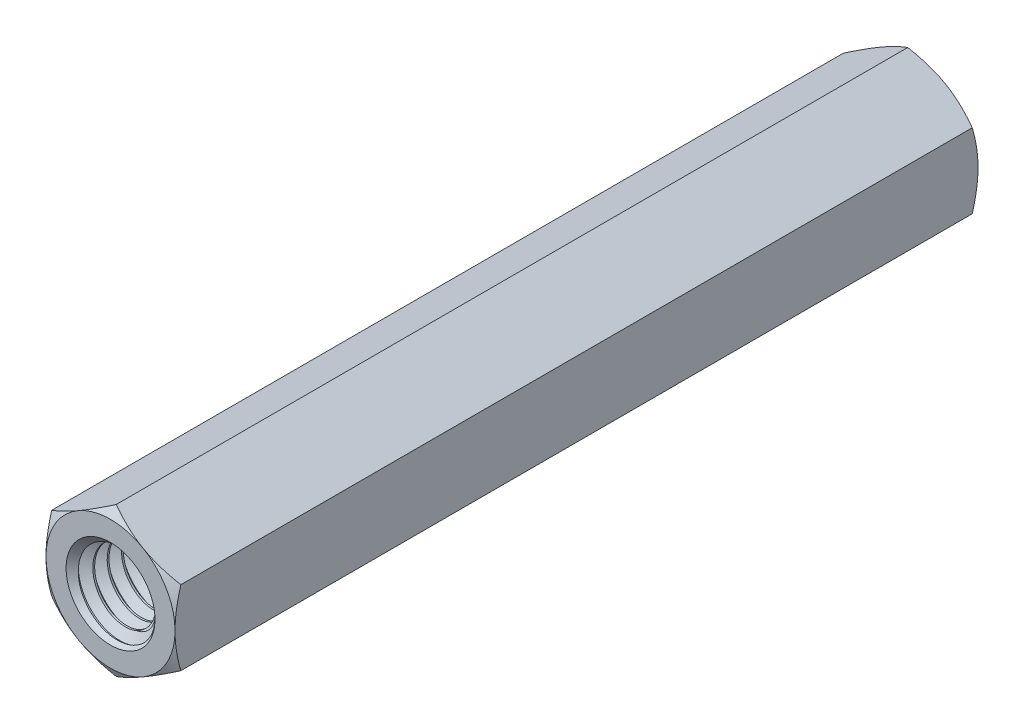
from build123d import *

# Parameters (mm, degrees)
EXTRUDE1_DEPTH          = 14
EXTRUDE1_DEPTH_BACK     = 14
SKETCH1_R               = 1.5
SWEEP1_PITCH            = 0.5
EXTRUDE2_DEPTH          = 29.706660889
SKETCH8_OUTSIDE_W       = 115.27
SKETCH8_OUTSIDE_H       = 115.966
SKETCH8_OUTSIDE_R       = 2.25
EXTRUDE4_DEPTH          = 29.706660889
EXTRUDE4_DRAFT          = -60
MIRROR1_COPY_1_SKETCH_W = 115.27
MIRROR1_COPY_1_SKETCH_H = 115.966
MIRROR1_COPY_1_SKETCH_R = 2.25
MIRROR1_COPY_1_DEPTH    = 29.706660889
MIRROR1_COPY_1_DRAFT    = -60
SKETCH9_W               = 15.4
SKETCH9_H               = 1.5508


with BuildPart() as part:
    # Sketch1 → Extrude1 (new, two sides: drawn at the far end of the back side and taken through both)
    with BuildSketch(Plane.XY.offset(-EXTRUDE1_DEPTH_BACK)):
        Polygon((0, 2.598076211), (-2.25, 1.299038106), (-2.25, -1.299038106), (0, -2.598076211), (2.25, -1.299038106), (2.25, 1.299038106), align=None)
        Circle(SKETCH1_R, mode=Mode.SUBTRACT)
    extrude(amount=EXTRUDE1_DEPTH + EXTRUDE1_DEPTH_BACK)

    # Sweep1: arcs per turn and ends read off the stored shape
    # Sweep1: the profile of Sketch12 profile screwed along a right-hand helix through 57 turns, 6 arcs to a turn; built about Z, then put on its axis
    sweep1_z = Axis((0, 0, 0), (0, 0, 1))
    sweep1_corners = [(1.5003, 0, -0.437673205), (1.5003, 0, 0.000173205), (1.175240474, 0, -0.1875), (1.175240474, 0, -0.25)]
    with BuildLine(mode=Mode.PRIVATE) as sweep1_profile:
        Line(sweep1_corners[0], sweep1_corners[1])
        Line(sweep1_corners[1], sweep1_corners[2])
        Line(sweep1_corners[2], sweep1_corners[3])
        Line(sweep1_corners[3], sweep1_corners[0])
    sweep1_cap = Face(sweep1_profile.wire())
    sweep1_turn_angles = [0, 30, 60, 90, 120, 150, 180, 210, 240, 270, 300, 330, 360]
    sweep1_turn_weights = [1, 0.8660254037844387, 1, 0.8660254037844387, 1, 0.8660254037844387, 1, 0.8660254037844387, 1, 0.8660254037844387, 1, 0.8660254037844387, 1]
    sweep1_turn_rails = [Edge.make_bspline([Vector(p[0], p[1], 0).rotate(sweep1_z, sweep1_turn_angles[k]) / sweep1_turn_weights[k] + Vector(0, 0, p[2] + SWEEP1_PITCH * sweep1_turn_angles[k] / 360) for k in range(13)], [0, 0, 0, 1, 1, 2, 2, 3, 3, 4, 4, 5, 5, 6, 6, 6], 2, sweep1_turn_weights) for p in sweep1_corners]
    sweep1_turn_sides = [Face.make_surface_from_curves(sweep1_turn_rails[p[0]], sweep1_turn_rails[p[1]]) for p in [(0, 1), (1, 2), (2, 3), (3, 0)]]
    sweep1 = Plane(origin=(0, 0, -14), x_dir=(0, 1, 0), z_dir=(0, 0, 1)) * Solid(Shell([*[p.moved(Location((0, 0, SWEEP1_PITCH * i))) for i in range(57) for p in sweep1_turn_sides], sweep1_cap, sweep1_cap.rotate(sweep1_z, 20520).moved(Location((0, 0, SWEEP1_PITCH * 20520 / 360)))]))
    add(sweep1)

    # Sketch6 → Extrude2 (cut, through all)
    with BuildSketch(Plane(origin=(0, 0, -14), x_dir=(-1, 0, 0), z_dir=(0, 0, -1))):
        Polygon((0, 2.598076211), (-2.25, 1.299038106), (-2.25, -1.299038106), (0, -2.598076211), (2.25, -1.299038106), (2.25, 1.299038106), align=None)
    extrude2 = extrude(amount=EXTRUDE2_DEPTH, mode=Mode.SUBTRACT)

    # Extrude3 cone 1 section (through the dimple's axis) → Extrude3 (revolve, cut)
    with BuildSketch(Plane(origin=(0, 0, -14), x_dir=(0, 1, 0), z_dir=(1, 0, 0))):
        Polygon((0, 0), (1.5508, 0), (0, 1.663029396), align=None)
    extrude3 = revolve(axis=Axis((0, 0, -14), (0, 0, 1)), mode=Mode.SUBTRACT)


with BuildPart() as extrude4_tool:
    # Sketch8 outside → Extrude4 (with draft: the straight prism first)
    with BuildSketch(Plane(origin=(0, 0, -14), x_dir=(-1, 0, 0), z_dir=(0, 0, -1))):
        Rectangle(SKETCH8_OUTSIDE_W, SKETCH8_OUTSIDE_H)
        Circle(SKETCH8_OUTSIDE_R, mode=Mode.SUBTRACT)
    extrude(amount=-EXTRUDE4_DEPTH)
    # Extrude4: the draft: its side faces are tilted about the plane it starts from
    extrude4_sides = [extrude4_tool.faces().sort_by_distance(p)[0] for p in [
        (0, -57.983, 0.853330444),
        (-57.635, 0, 0.853330444),
        (0, 57.983, 0.853330444),
        (57.635, 0, 0.853330444),
        (2.25, 0, 0.853330444),
    ]]
    draft(extrude4_sides, Plane(origin=(0, 0, -14), x_dir=(-1, 0, 0), z_dir=(0, 0, -1)), EXTRUDE4_DRAFT)


with BuildPart() as part_1:
    add(part.part)

    # Extrude4: cut by extrude4_tool
    add(extrude4_tool.part, mode=Mode.SUBTRACT)

    # Mirror1: Extrude2, Extrude3 across plane
    add(extrude2.mirror(Plane.XY), mode=Mode.SUBTRACT)
    add(extrude3.mirror(Plane.XY), mode=Mode.SUBTRACT)


with BuildPart() as mirror1_copy_1_tool:
    # Mirror1 copy 1 sketch → Mirror1 copy 1 (with draft: the straight prism first)
    with BuildSketch(Plane(origin=(0, 0, 14), x_dir=(-1, 0, 0), z_dir=(0, 0, 1))):
        Rectangle(MIRROR1_COPY_1_SKETCH_W, MIRROR1_COPY_1_SKETCH_H)
        Circle(MIRROR1_COPY_1_SKETCH_R, mode=Mode.SUBTRACT)
    extrude(amount=-MIRROR1_COPY_1_DEPTH)
    # Mirror1 copy 1: the draft: its side faces are tilted about the plane it starts from
    mirror1_copy_1_sides = [mirror1_copy_1_tool.faces().sort_by_distance(p)[0] for p in [
        (0, -57.983, -0.853330444),
        (-57.635, 0, -0.853330444),
        (0, 57.983, -0.853330444),
        (57.635, 0, -0.853330444),
        (2.25, 0, -0.853330444),
    ]]
    draft(mirror1_copy_1_sides, Plane(origin=(0, 0, 14), x_dir=(-1, 0, 0), z_dir=(0, 0, 1)), MIRROR1_COPY_1_DRAFT)


with BuildPart() as part_2:
    add(part_1.part)

    # Mirror1 copy 1: cut by mirror1_copy_1_tool
    add(mirror1_copy_1_tool.part, mode=Mode.SUBTRACT)

    # Sketch9 → Revolve 2 (revolve)
    with BuildSketch(Plane(origin=(0, 0, 0), x_dir=(0, 0, -1), z_dir=(1, 0, 0)), mode=Mode.PRIVATE) as revolve_2_sk:
        with Locations((0, 0.7754)):
            Rectangle(SKETCH9_W, SKETCH9_H)
    revolve(revolve_2_sk.sketch.rotate(Axis((0, 0, 14), (0, 0, -1)), 270), axis=Axis((0, 0, 14), (0, 0, -1)))


solid = part_2.part
